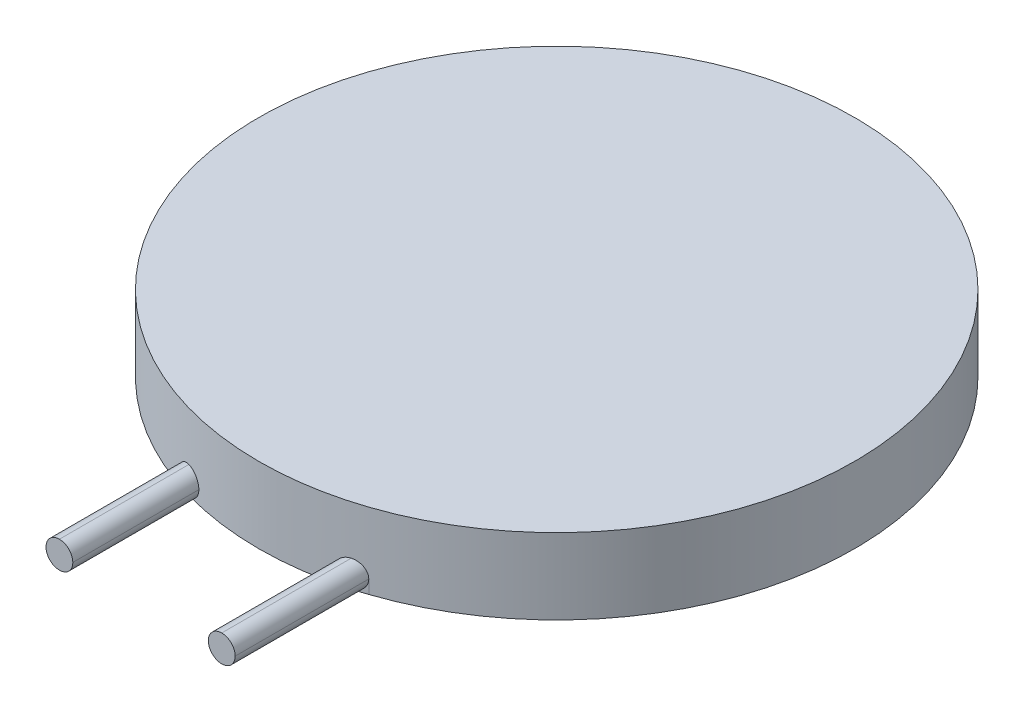
from build123d import *

# Parameters (mm, degrees)
SKETCH1_R           = 20.0025
BOSS_EXTRUDE1_DEPTH = 5.08
SKETCH2_W           = 1.8
SKETCH2_H           = 15.24
BOSS_EXTRUDE2_DEPTH = 1.8
FILLET1_R           = 0.9


with BuildPart() as part:
    # Sketch1 → Boss-Extrude1 (new body)
    with BuildSketch(Plane(origin=(0, 0, 0), x_dir=(1, 0, 0), z_dir=(0, 1, 0))):
        with Locations(Location((0, 0, 0), (0, 0, 270))):
            Circle(SKETCH1_R)
    extrude(amount=BOSS_EXTRUDE1_DEPTH)

    # Sketch2 → Boss-Extrude2 (add)
    with BuildSketch(Plane.XZ):
        with Locations((-5.45, 20.32)):
            Rectangle(SKETCH2_W, SKETCH2_H)
        with Locations((5.45, 20.32)):
            Rectangle(SKETCH2_W, SKETCH2_H)
    extrude(amount=-BOSS_EXTRUDE2_DEPTH)

    # Fillet1
    fillet1_edges = [part.edges().sort_by_distance(p)[0] for p in [
        (6.35, 1.8, 23.453900915),
        (6.35, 0, 23.453900915),
        (4.55, 1.8, 23.70906446),
        (4.55, 0, 23.70906446),
        (-6.35, 1.8, 23.453900915),
        (-4.55, 1.8, 23.70906446),
        (-6.35, 0, 23.453900915),
        (-4.55, 0, 23.70906446),
    ]]
    fillet(fillet1_edges, radius=FILLET1_R - 0.0001)  # a hair under: the kernel refuses the full size


solid = part.part
